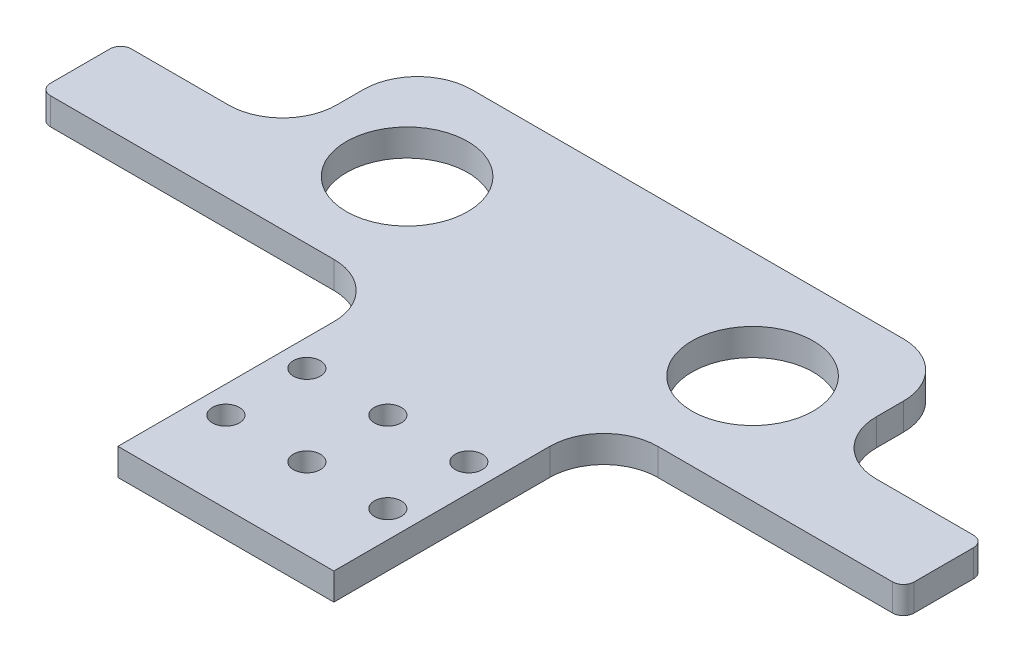
from build123d import *

# Parameters (mm, degrees)
SKETCH2_W            = 127
SKETCH2_H            = 50.8
BOSS_EXTRUDE1_DEPTH  = 6.35
SKETCH3_R            = 14.2875
CUT_EXTRUDE1_DEPTH   = 6.35
SKETCH6_W            = 38.1
SKETCH6_H            = 19.05
BOSS_EXTRUDE2_DEPTH  = 6.35
FILLET2_R            = 12.7
FILLET1_R            = 2.54
SKETCH8_W            = 50.8
SKETCH8_H            = 63.5
BOSS_EXTRUDE3_DEPTH  = 6.35
FILLET3_R            = 12.7
SKETCH9_R            = 3.175
CUT_EXTRUDE2_DEPTH   = 6.35
LPATTERN1_COUNT      = 3
LPATTERN1_PITCH      = 19.05
LPATTERN1_COUNT_DIR2 = 2
LPATTERN1_PITCH_DIR2 = 19.05


with BuildPart() as part:
    # Sketch2 → Boss-Extrude1 (new body)
    with BuildSketch(Plane(origin=(0, 0, 0), x_dir=(1, 0, 0), z_dir=(0, 1, 0))):
        with Locations((11.099270833, 15.531041667)):
            Rectangle(SKETCH2_W, SKETCH2_H)
    extrude(amount=BOSS_EXTRUDE1_DEPTH)

    # Sketch3 → Cut-Extrude1 (cut)
    with BuildSketch(Plane(origin=(0, 6.35, 0), x_dir=(1, 0, 0), z_dir=(0, 1, 0))):
        with Locations((-29.540729167, 15.61478805)):
            Circle(SKETCH3_R)
    cut_extrude1 = extrude(amount=-CUT_EXTRUDE1_DEPTH, mode=Mode.SUBTRACT)

    # Mirror1: Cut-Extrude1 across plane
    add(cut_extrude1.mirror(Plane(origin=(11.099270833, 0, 0), x_dir=(0, 0, 1), z_dir=(1, 0, 0))), mode=Mode.SUBTRACT)

    # Sketch6 → Boss-Extrude2 (add)
    with BuildSketch(Plane(origin=(0, 6.35, 0), x_dir=(1, 0, 0), z_dir=(0, 1, 0))):
        with Locations((-71.450729167, -0.343958333)):
            Rectangle(SKETCH6_W, SKETCH6_H)
    boss_extrude2 = extrude(amount=-BOSS_EXTRUDE2_DEPTH)

    # Mirror2: Boss-Extrude2 across plane
    add(boss_extrude2.mirror(Plane(origin=(11.099270833, 0, 0), x_dir=(0, 0, 1), z_dir=(1, 0, 0))))

    # Fillet2
    fillet2_edges = [part.edges().sort_by_distance(p)[0] for p in [
        (74.599270833, 3.175, -9.181041667),
        (-52.400729167, 3.175, -9.181041667),
        (-52.400729167, 3.175, -40.931041667),
        (74.599270833, 3.175, -40.931041667),
    ]]
    fillet(fillet2_edges, radius=FILLET2_R)

    # Fillet1
    fillet1_edges = [part.edges().sort_by_distance(p)[0] for p in [
        (112.699270833, 3.175, 9.868958333),
        (112.699270833, 3.175, -9.181041667),
        (-90.500729167, 3.175, 9.868958333),
        (-90.500729167, 3.175, -9.181041667),
    ]]
    fillet(fillet1_edges, radius=FILLET1_R)

    # Sketch8 → Boss-Extrude3 (add)
    with BuildSketch(Plane(origin=(0, 6.35, 0), x_dir=(1, 0, 0), z_dir=(0, 1, 0))):
        with Locations((16.814270833, -41.618958333)):
            Rectangle(SKETCH8_W, SKETCH8_H)
    extrude(amount=-BOSS_EXTRUDE3_DEPTH)

    # Fillet3
    fillet3_edges = [part.edges().sort_by_distance(p)[0] for p in [
        (42.214270833, 3.175, 9.868958333),
        (-8.585729167, 3.175, 9.868958333),
    ]]
    fillet(fillet3_edges, radius=FILLET3_R)

    # Sketch9 → Cut-Extrude2 (cut)
    with BuildSketch(Plane(origin=(0, 6.35, 0), x_dir=(1, 0, 0), z_dir=(0, 1, 0))):
        with Locations((-2.235729167, -54.318958333)):
            Circle(SKETCH9_R)
    cut_extrude2 = extrude(amount=-CUT_EXTRUDE2_DEPTH, mode=Mode.SUBTRACT)

    # LPattern1: Cut-Extrude2 3 × 2
    with Locations(*[(i * LPATTERN1_PITCH, 0, -j * LPATTERN1_PITCH_DIR2) for i in range(LPATTERN1_COUNT) for j in range(LPATTERN1_COUNT_DIR2) if (i, j) != (0, 0)]):
        add(cut_extrude2, mode=Mode.SUBTRACT)


solid = part.part
